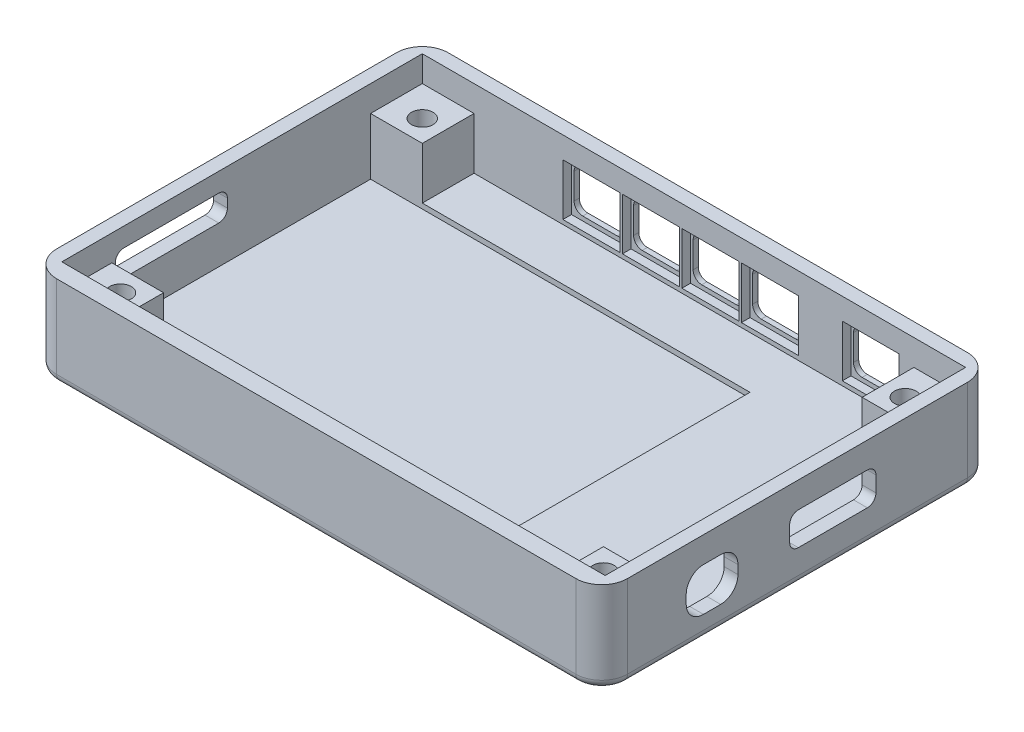
from build123d import *

# Parameters (mm, degrees)
SKETCH_1_W             = 63
SKETCH_1_H             = 42
EXTRUDE_298_DEPTH      = 1.6
SKETCH_2_W             = 44
SKETCH_2_H             = 30
CUT_EXTRUDE_685_DEPTH  = 0.6
SKETCH_4_W             = 1.6
SKETCH_4_H             = 42
EXTRUDE_929_DEPTH      = 10.6
SKETCH_5_W             = 6
SKETCH_5_H             = 6
EXTRUDE_1327_DEPTH     = 6
SKETCH_6_R             = 1.25
CUT_EXTRUDE_1660_DEPTH = 9
SKETCH_9_W             = 66.2
SKETCH_9_H             = 10.6
EXTRUDE_4_DEPTH        = 1.6
SKETCH_10_W            = 6.6
SKETCH_10_H            = 6
CUT_EXTRUDE_2783_DEPTH = 1
CUT_EXTRUDE_3291_REACH = 57.006
FILLET_4_R             = 1
FILLET_5_R             = 3
TF_REACH               = 71.028
USB_REACH              = 71.028
EXTRUDE_START          = 1.8
EXTRUDE_5781_DEPTH     = 1.8
FILLET_7_R             = 3
FILLET_8_R             = 1
EXTRUDE_5_DEPTH        = 0.2
BOOT_REACH             = 43.188
SKETCH_25_R            = 1


with BuildPart() as part:
    # 草图1 → Extrude 298 (new body)
    with BuildSketch(Plane(origin=(0, 0, 0), x_dir=(1, 0, 0), z_dir=(0, 1, 0))):
        Rectangle(SKETCH_1_W, SKETCH_1_H)
    extrude(amount=-EXTRUDE_298_DEPTH)

    # 草图2 → Cut-Extrude 685 (cut)
    with BuildSketch(Plane(origin=(0, 0, 0), x_dir=(1, 0, 0), z_dir=(0, 1, 0))):
        with Locations((-9.5, 0)):
            Rectangle(SKETCH_2_W, SKETCH_2_H)
    extrude(amount=-CUT_EXTRUDE_685_DEPTH, mode=Mode.SUBTRACT)

    # 草图4 → Extrude 929 (add)
    with BuildSketch(Plane(origin=(0, -1.6, 0), x_dir=(-1, 0, 0), z_dir=(0, -1, 0))):
        with Locations((-32.3, 0)):
            Rectangle(SKETCH_4_W, SKETCH_4_H)
        with Locations((32.3, 0)):
            Rectangle(SKETCH_4_W, SKETCH_4_H)
    extrude(amount=-EXTRUDE_929_DEPTH)

    # 草图5 → Extrude 1327 (add)
    with BuildSketch(Plane(origin=(0, 0, 0), x_dir=(1, 0, 0), z_dir=(0, 1, 0))):
        with Locations((-28.5, 18)):
            Rectangle(SKETCH_5_W, SKETCH_5_H)
        with Locations((28.5, 18)):
            Rectangle(SKETCH_5_W, SKETCH_5_H)
        with Locations((-28.5, -18)):
            Rectangle(SKETCH_5_W, SKETCH_5_H)
        with Locations((28.5, -18)):
            Rectangle(SKETCH_5_W, SKETCH_5_H)
    extrude(amount=EXTRUDE_1327_DEPTH)

    # 草图6 → Cut-Extrude 1660 (cut)
    with BuildSketch(Plane(origin=(0, 9, 0), x_dir=(1, 0, 0), z_dir=(0, 1, 0))):
        with Locations(Location((-28, 17.5, 0), (0, 0, 270))):
            Circle(SKETCH_6_R)
        with Locations(Location((28, 17.5, 0), (0, 0, 270))):
            Circle(SKETCH_6_R)
        with Locations(Location((28, -17.5, 0), (0, 0, 270))):
            Circle(SKETCH_6_R)
        with Locations(Location((-28, -17.5, 0), (0, 0, 270))):
            Circle(SKETCH_6_R)
    extrude(amount=-CUT_EXTRUDE_1660_DEPTH, mode=Mode.SUBTRACT)

    # 草图9 → 凸台-拉伸4 (add)
    with BuildSketch(Plane(origin=(0, 0, -21), x_dir=(-1, 0, 0), z_dir=(0, 0, -1))):
        with Locations((0, 3.7)):
            Rectangle(SKETCH_9_W, SKETCH_9_H)
    extrude(amount=EXTRUDE_4_DEPTH)

    # 草图10 → Cut-Extrude 2783 (cut)
    with BuildSketch(Plane.XY.offset(-21)):
        with Locations((20.5, 3.5)):
            Rectangle(SKETCH_10_W, SKETCH_10_H)
        with Locations((8.8, 3.5)):
            Rectangle(SKETCH_10_W, SKETCH_10_H)
        with Locations((1.9, 3.5)):
            Rectangle(SKETCH_10_W, SKETCH_10_H)
        with Locations((-5, 3.5)):
            Rectangle(SKETCH_10_W, SKETCH_10_H)
        with Locations((-11.9, 3.5)):
            Rectangle(SKETCH_10_W, SKETCH_10_H)
    extrude(amount=-CUT_EXTRUDE_2783_DEPTH, mode=Mode.SUBTRACT)

    # 草图12 → Cut-Extrude 3291 (cut, up to next)
    with BuildSketch(Plane.XY.offset(-22), mode=Mode.PRIVATE) as cut_extrude_3291_sk1:
        with BuildLine():
            Line((5.8, 2), (5.8, 5))
            ThreePointArc((5.8, 5), (6.092893219, 5.707106781), (6.8, 6))
            Line((6.8, 6), (10.8, 6))
            ThreePointArc((10.8, 6), (11.507106781, 5.707106781), (11.8, 5))
            Line((11.8, 5), (11.8, 2))
            ThreePointArc((11.8, 2), (11.507106781, 1.292893219), (10.8, 1))
            Line((10.8, 1), (6.8, 1))
            ThreePointArc((6.8, 1), (6.092893219, 1.292893219), (5.8, 2))
        make_face()
    cut_extrude_3291_tool1 = extrude(cut_extrude_3291_sk1.sketch, amount=-CUT_EXTRUDE_3291_REACH, mode=Mode.PRIVATE) & part.part
    # 草图12 → Cut-Extrude 3291 (cut, up to next)
    with BuildSketch(Plane.XY.offset(-22), mode=Mode.PRIVATE) as cut_extrude_3291_sk2:
        with BuildLine():
            Line((18.5, 1), (22.5, 1))
            ThreePointArc((22.5, 1), (23.207106781, 1.292893219), (23.5, 2))
            Line((23.5, 2), (23.5, 5))
            ThreePointArc((23.5, 5), (23.207106781, 5.707106781), (22.5, 6))
            Line((22.5, 6), (18.5, 6))
            ThreePointArc((18.5, 6), (17.792893219, 5.707106781), (17.5, 5))
            Line((17.5, 5), (17.5, 2))
            ThreePointArc((17.5, 2), (17.792893219, 1.292893219), (18.5, 1))
        make_face()
    cut_extrude_3291_tool2 = extrude(cut_extrude_3291_sk2.sketch, amount=-CUT_EXTRUDE_3291_REACH, mode=Mode.PRIVATE) & part.part
    # 草图12 → Cut-Extrude 3291 (cut, up to next)
    with BuildSketch(Plane.XY.offset(-22), mode=Mode.PRIVATE) as cut_extrude_3291_sk3:
        with BuildLine():
            Line((-1.1, 2), (-1.1, 5))
            ThreePointArc((-1.1, 5), (-0.807106781, 5.707106781), (-0.1, 6))
            Line((-0.1, 6), (3.9, 6))
            ThreePointArc((3.9, 6), (4.607106781, 5.707106781), (4.9, 5))
            Line((4.9, 5), (4.9, 2))
            ThreePointArc((4.9, 2), (4.607106781, 1.292893219), (3.9, 1))
            Line((3.9, 1), (-0.1, 1))
            ThreePointArc((-0.1, 1), (-0.807106781, 1.292893219), (-1.1, 2))
        make_face()
    cut_extrude_3291_tool3 = extrude(cut_extrude_3291_sk3.sketch, amount=-CUT_EXTRUDE_3291_REACH, mode=Mode.PRIVATE) & part.part
    # 草图12 → Cut-Extrude 3291 (cut, up to next)
    with BuildSketch(Plane.XY.offset(-22), mode=Mode.PRIVATE) as cut_extrude_3291_sk4:
        with BuildLine():
            Line((-8, 2), (-8, 5))
            ThreePointArc((-8, 5), (-7.707106781, 5.707106781), (-7, 6))
            Line((-7, 6), (-3, 6))
            ThreePointArc((-3, 6), (-2.292893219, 5.707106781), (-2, 5))
            Line((-2, 5), (-2, 2))
            ThreePointArc((-2, 2), (-2.292893219, 1.292893219), (-3, 1))
            Line((-3, 1), (-7, 1))
            ThreePointArc((-7, 1), (-7.707106781, 1.292893219), (-8, 2))
        make_face()
    cut_extrude_3291_tool4 = extrude(cut_extrude_3291_sk4.sketch, amount=-CUT_EXTRUDE_3291_REACH, mode=Mode.PRIVATE) & part.part
    # 草图12 → Cut-Extrude 3291 (cut, up to next)
    with BuildSketch(Plane.XY.offset(-22), mode=Mode.PRIVATE) as cut_extrude_3291_sk5:
        with BuildLine():
            Line((-14.9, 2), (-14.9, 5))
            ThreePointArc((-14.9, 5), (-14.607106781, 5.707106781), (-13.9, 6))
            Line((-13.9, 6), (-9.9, 6))
            ThreePointArc((-9.9, 6), (-9.192893219, 5.707106781), (-8.9, 5))
            Line((-8.9, 5), (-8.9, 2))
            ThreePointArc((-8.9, 2), (-9.192893219, 1.292893219), (-9.9, 1))
            Line((-9.9, 1), (-13.9, 1))
            ThreePointArc((-13.9, 1), (-14.607106781, 1.292893219), (-14.9, 2))
        make_face()
    cut_extrude_3291_tool5 = extrude(cut_extrude_3291_sk5.sketch, amount=-CUT_EXTRUDE_3291_REACH, mode=Mode.PRIVATE) & part.part
    add(cut_extrude_3291_tool1.solids().sort_by_distance((8.8, 3.5, -22))[0], mode=Mode.SUBTRACT)
    add(cut_extrude_3291_tool2.solids().sort_by_distance((20.5, 3.5, -22))[0], mode=Mode.SUBTRACT)
    add(cut_extrude_3291_tool3.solids().sort_by_distance((1.9, 3.5, -22))[0], mode=Mode.SUBTRACT)
    add(cut_extrude_3291_tool4.solids().sort_by_distance((-5, 3.5, -22))[0], mode=Mode.SUBTRACT)
    add(cut_extrude_3291_tool5.solids().sort_by_distance((-11.9, 3.5, -22))[0], mode=Mode.SUBTRACT)

    # 圆角4
    fillet_4_edges = [part.edges().sort_by_distance(p)[0] for p in [
        (0, -1.6, -22.6),
        (33.1, -1.6, -0.8),
        (-33.1, -1.6, -0.8),
    ]]
    fillet(fillet_4_edges, radius=FILLET_4_R)

    # 圆角5
    # the kernel refuses this fillet: 3 mm, written as the material it takes off along each edge
    with BuildSketch(Plane(origin=(30.1, -1.6, -19.6), x_dir=(0, 0, -1), z_dir=(-1, 0, 0))) as fillet_5_piece_1:
        with BuildLine():
            CenterArc((2, -1), 1, 0, 90)
            Line((3, -1), (3, 0))
            Line((3, 0), (2, 0))
        make_face()
    revolve(axis=Axis((30.1, -1.6, -19.6), (0, -1, 0)), revolution_arc=90, mode=Mode.SUBTRACT)
    with BuildSketch(Plane(origin=(-30.1, -1.6, -19.6), x_dir=(-1, 0, 0), z_dir=(0, 0, 1))) as fillet_5_piece_2:
        with BuildLine():
            CenterArc((2, -1), 1, 0, 90)
            Line((3, -1), (3, 0))
            Line((3, 0), (2, 0))
        make_face()
    revolve(axis=Axis((-30.1, -1.6, -19.6), (0, -1, 0)), revolution_arc=90, mode=Mode.SUBTRACT)
    with BuildSketch(Plane(origin=(33.1, 16.5, -22.6), x_dir=(0, 0, 1), z_dir=(0, -1, 0)), Plane(origin=(-33.1, -1.6, -22.6), x_dir=(0, 0, 1), z_dir=(0, 1, 0))) as fillet_5_piece_3:
        with BuildLine():
            CenterArc((FILLET_5_R, FILLET_5_R), FILLET_5_R, 180, 90)
            Line((0, FILLET_5_R), (0, 0))
            Line((0, 0), (FILLET_5_R, 0))
        make_face()
    extrude(amount=18.1, mode=Mode.SUBTRACT)

    # 草图16 → tf (cut, up to next)
    with BuildSketch(Plane(origin=(-31.5, 0, 0), x_dir=(0, 0, -1), z_dir=(1, 0, 0)), mode=Mode.PRIVATE) as tf_sk1:
        with BuildLine():
            Line((-14.6, 5.8), (-14.6, 4.8))
            ThreePointArc((-14.6, 4.8), (-14.307106781, 4.092893219), (-13.6, 3.8))
            Line((-13.6, 3.8), (-2.6, 3.8))
            ThreePointArc((-2.6, 3.8), (-1.892893219, 4.092893219), (-1.6, 4.8))
            Line((-1.6, 4.8), (-1.6, 5.8))
            ThreePointArc((-1.6, 5.8), (-1.892893219, 6.507106781), (-2.6, 6.8))
            Line((-2.6, 6.8), (-13.6, 6.8))
            ThreePointArc((-13.6, 6.8), (-14.307106781, 6.507106781), (-14.6, 5.8))
        make_face()
    tf_tool1 = extrude(tf_sk1.sketch, amount=-TF_REACH, mode=Mode.PRIVATE) & part.part
    add(tf_tool1.solids().sort_by_distance((-31.5, 5.3, 8.1))[0], mode=Mode.SUBTRACT)

    # 草图17 → usb (cut, up to next)
    with BuildSketch(Plane.ZY.offset(-31.5), mode=Mode.PRIVATE) as usb_sk1:
        with BuildLine():
            Line((7, 4), (7, 3))
            ThreePointArc((7, 3), (7.585786438, 1.585786438), (9, 1))
            Line((9, 1), (11, 1))
            ThreePointArc((11, 1), (12.414213562, 1.585786438), (13, 3))
            Line((13, 3), (13, 4))
            ThreePointArc((13, 4), (12.414213562, 5.414213562), (11, 6))
            Line((11, 6), (9, 6))
            ThreePointArc((9, 6), (7.585786438, 5.414213562), (7, 4))
        make_face()
    usb_tool1 = extrude(usb_sk1.sketch, amount=-USB_REACH, mode=Mode.PRIVATE) & part.part
    # 草图17 → usb (cut, up to next)
    with BuildSketch(Plane.ZY.offset(-31.5), mode=Mode.PRIVATE) as usb_sk2:
        with BuildLine():
            Line((1, 5), (1, 3.2))
            ThreePointArc((1, 3.2), (0.707106781, 2.492893219), (0, 2.2))
            Line((0, 2.2), (-8, 2.2))
            ThreePointArc((-8, 2.2), (-8.707106781, 2.492893219), (-9, 3.2))
            Line((-9, 3.2), (-9, 5))
            ThreePointArc((-9, 5), (-8.707106781, 5.707106781), (-8, 6))
            Line((-8, 6), (0, 6))
            ThreePointArc((0, 6), (0.707106781, 5.707106781), (1, 5))
        make_face()
    usb_tool2 = extrude(usb_sk2.sketch, amount=-USB_REACH, mode=Mode.PRIVATE) & part.part
    add(usb_tool1.solids().sort_by_distance((31.5, 3.5, 10))[0], mode=Mode.SUBTRACT)
    add(usb_tool2.solids().sort_by_distance((31.5, 4.1, -4))[0], mode=Mode.SUBTRACT)

    # 草图18 → Extrude 5781 (add)
    with BuildSketch(Plane.XY.offset(21).offset(EXTRUDE_START)):
        with BuildLine():
            Line((33.1, 9), (33.1, -0.6))
            ThreePointArc((33.1, -0.6), (32.807106781, -1.307106781), (32.1, -1.6))
            Line((32.1, -1.6), (-32.1, -1.6))
            ThreePointArc((-32.1, -1.6), (-32.807106781, -1.307106781), (-33.1, -0.6))
            Line((-33.1, -0.6), (-33.1, 9))
            Line((-33.1, 9), (33.1, 9))
        make_face()
    extrude(amount=-EXTRUDE_5781_DEPTH)

    # 圆角7
    # the kernel refuses this fillet: 3 mm, written as the material it takes off along each edge
    with BuildSketch(Plane(origin=(33.1, 16.5, 22.8), x_dir=(0, 0, -1), z_dir=(0, -1, 0)), Plane(origin=(-33.1, -8.1, 22.8), x_dir=(0, 0, -1), z_dir=(0, 1, 0))) as fillet_7_piece_1:
        with BuildLine():
            CenterArc((FILLET_7_R, -FILLET_7_R), FILLET_7_R, 90, 90)
            Line((0, -FILLET_7_R), (0, 0))
            Line((0, 0), (FILLET_7_R, 0))
        make_face()
    extrude(amount=24.6, mode=Mode.SUBTRACT)

    # 圆角8
    # the kernel refuses this fillet: 1 mm, written as the material it takes off along each edge
    with BuildSketch(Plane(origin=(-30.1, -1.6, 19.8), x_dir=(0, 0, 1), z_dir=(1, 0, 0))) as fillet_8_piece_1:
        with BuildLine():
            CenterArc((3 - FILLET_8_R, -FILLET_8_R), FILLET_8_R, 0, 90)
            Line((3 - FILLET_8_R, 0), (3, 0))
            Line((3, 0), (3, -FILLET_8_R))
        make_face()
    revolve(axis=Axis((-30.1, -1.6, 19.8), (0, -1, 0)), revolution_arc=89.560936277, mode=Mode.SUBTRACT)
    with BuildSketch(Plane(origin=(30.1, -1.6, 19.8), x_dir=(0, 0, 1), z_dir=(-1, 0, 0))) as fillet_8_piece_2:
        with BuildLine():
            CenterArc((3 - FILLET_8_R, FILLET_8_R), FILLET_8_R, 270, 90)
            Line((3 - FILLET_8_R, 0), (3, 0))
            Line((3, 0), (3, FILLET_8_R))
        make_face()
    revolve(axis=Axis((30.1, -1.6, 19.8), (0, 1, 0)), revolution_arc=89.560936277, mode=Mode.SUBTRACT)
    with BuildSketch(Plane(origin=(30.1, -1.6, 22.8), x_dir=(0, 1, 0), z_dir=(-1, 0, 0))) as fillet_8_piece_3:
        with BuildLine():
            CenterArc((FILLET_8_R, FILLET_8_R), FILLET_8_R, 180, 90)
            Line((0, FILLET_8_R), (0, 0))
            Line((0, 0), (FILLET_8_R, 0))
        make_face()
    extrude(amount=60.2, mode=Mode.SUBTRACT)

    # 草图19 → 凸台-拉伸5 (add)
    with BuildSketch(Plane(origin=(0, 0, 21), x_dir=(-1, 0, 0), z_dir=(0, 0, -1))):
        Polygon((31.5, 9), (-31.5, 9), (-31.5, 6), (-25.5, 6), (-25.5, 0), (25.5, 0), (25.5, 6), (31.5, 6), align=None)
    extrude(amount=EXTRUDE_5_DEPTH)

    # 草图25 → BOOT孔 (cut, up to next)
    with BuildSketch(Plane(origin=(0, 0, 0), x_dir=(1, 0, 0), z_dir=(0, 1, 0)), mode=Mode.PRIVATE) as boot_sk1:
        with Locations(Location((25.5, 12, 0), (0, 0, 270))):
            Circle(SKETCH_25_R)
    boot_tool1 = extrude(boot_sk1.sketch, amount=-BOOT_REACH, mode=Mode.PRIVATE) & part.part
    add(boot_tool1.solids().sort_by_distance((25.5, 0, -12))[0], mode=Mode.SUBTRACT)


solid = part.part
